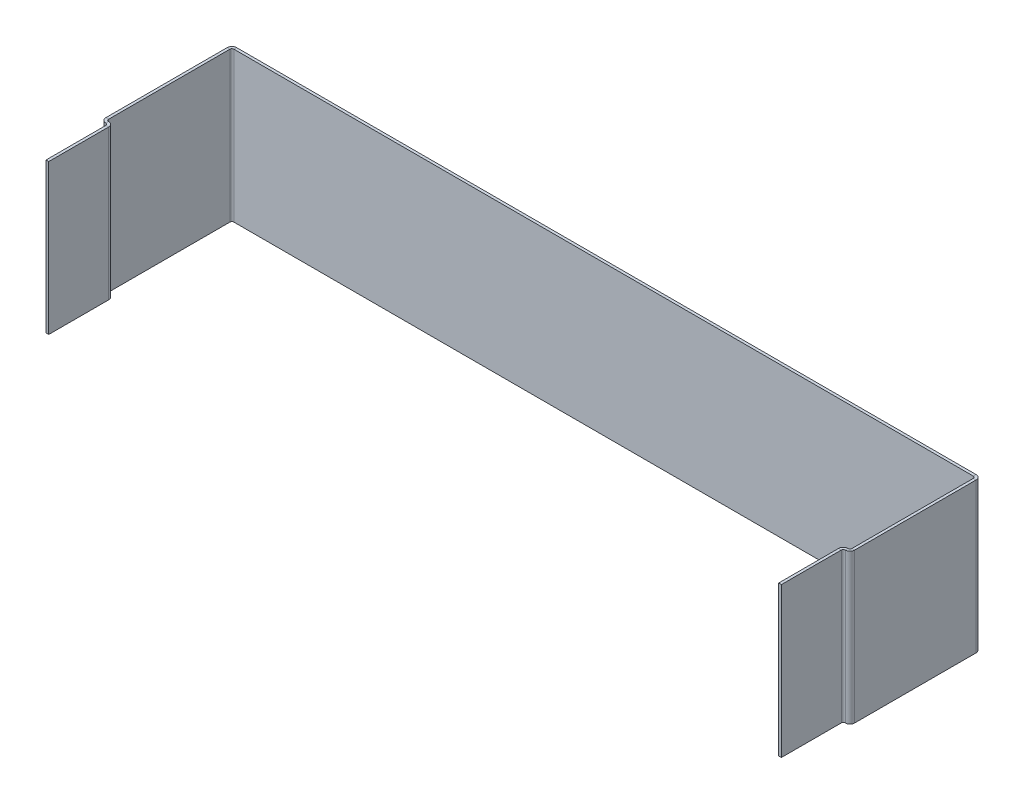
from build123d import *

# Parameters (mm, degrees)
SKETCH_1_W                       = 137.5
SKETCH_1_H                       = 55
SM_BASE_FLANGE_1_DEPTH           = 1
SM_EDGE_FLANGE_3_STRIP_W         = 5.4732
SM_EDGE_FLANGE_3_STRIP_H         = 1
SM_EDGE_FLANGE_3_STRIP_CUT_DEPTH = 55
SM_EDGE_FLANGE_3_DEPTH           = 55
OTHER_START                      = -27.5
OTHER_1_DEPTH                    = 55
OTHER_1_2_DEPTH                  = 55


# Read off the part's stored shape, not the designer's step: Изгиб1
# Sheet-metal steps are written as plain solids
with BuildPart() as part:
    # Sketch 1 → Базовая кромка1 (new body)
    with BuildSketch(Plane.XY):
        with Locations((-68.75, 0)):
            Rectangle(SKETCH_1_W, SKETCH_1_H)
    extrude(amount=-SM_BASE_FLANGE_1_DEPTH)

    # Ребро-кромка3 strip (across the edge) → Ребро-кромка3 strip cut (cut)
    with BuildSketch(Plane(origin=(-137.5, 27.5, 0), x_dir=(1, 0, 0), z_dir=(0, -1, 0))):
        with Locations((-1, -0.5)):
            Rectangle(SM_EDGE_FLANGE_3_STRIP_W, SM_EDGE_FLANGE_3_STRIP_H)
    extrude(amount=SM_EDGE_FLANGE_3_STRIP_CUT_DEPTH, mode=Mode.SUBTRACT)

    # Ребро-кромка3 section (across the edge) → Ребро-кромка3 (add)
    with BuildSketch(Plane(origin=(-137.5, 27.5, 0), x_dir=(1, 0, 0), z_dir=(0, -1, 0))):
        with BuildLine():
            Line((0, 0.7366), (0, 69.7366))
            Line((0, 69.7366), (1, 69.7366))
            Line((1, 69.7366), (1, 0.7366))
            ThreePointArc((1, 0.7366), (1.215745145, 0.215745145), (1.7366, 0))
            Line((1.7366, 0), (1.7366, -1))
            ThreePointArc((1.7366, -1), (0.508638364, -0.491361636), (0, 0.7366))
        make_face()
    extrude(amount=SM_EDGE_FLANGE_3_DEPTH)

    # Other 1 outline → Other 1 (cut)
    with BuildSketch(Plane(origin=(0, 0, 0), x_dir=(1, 0, 0), z_dir=(0, 1, 0)).offset(OTHER_START)):
        with BuildLine():
            ThreePointArc((-136.5, -46.86049542), (-137.228828115, -46.219680493), (-137.5, -45.287854329))
            Line((-137.5, -45.287854329), (-137.5, -69.7366))
            Line((-137.5, -69.7366), (-136.5, -69.7366))
            Line((-136.5, -69.7366), (-136.5, -46.86049542))
        make_face()
    extrude(amount=OTHER_1_DEPTH, mode=Mode.SUBTRACT)

    # Other 1 2 outline → Other 1 2 (add)
    with BuildSketch(Plane(origin=(0, 0, 0), x_dir=(1, 0, 0), z_dir=(0, 1, 0)).offset(OTHER_START)):
        with BuildLine():
            Line((-136.5, -45.287854329), (-136.5, -46.86049542))
            ThreePointArc((-136.5, -46.86049542), (-136.140713558, -46.982969086), (-135.7634, -47.024454329))
            ThreePointArc((-135.7634, -47.024454329), (-135.242545145, -47.240199474), (-135.0268, -47.761054329))
            Line((-135.0268, -47.761054329), (-135.0268, -69.7366))
            Line((-135.0268, -69.7366), (-134.0268, -69.7366))
            Line((-134.0268, -69.7366), (-134.0268, -47.761054329))
            ThreePointArc((-134.0268, -47.761054329), (-134.535438364, -46.533092693), (-135.7634, -46.024454329))
            ThreePointArc((-135.7634, -46.024454329), (-136.284254855, -45.808709184), (-136.5, -45.287854329))
        make_face()
    extrude(amount=OTHER_1_2_DEPTH)

    # Зеркальное отражение1: part across plane


with BuildPart() as part_1:
    add(part.part)
    add(part.part.mirror(Plane(origin=(0, -27.5, -1), x_dir=(0, 0, 1), z_dir=(1, 0, 0))))


solid = part_1.part
